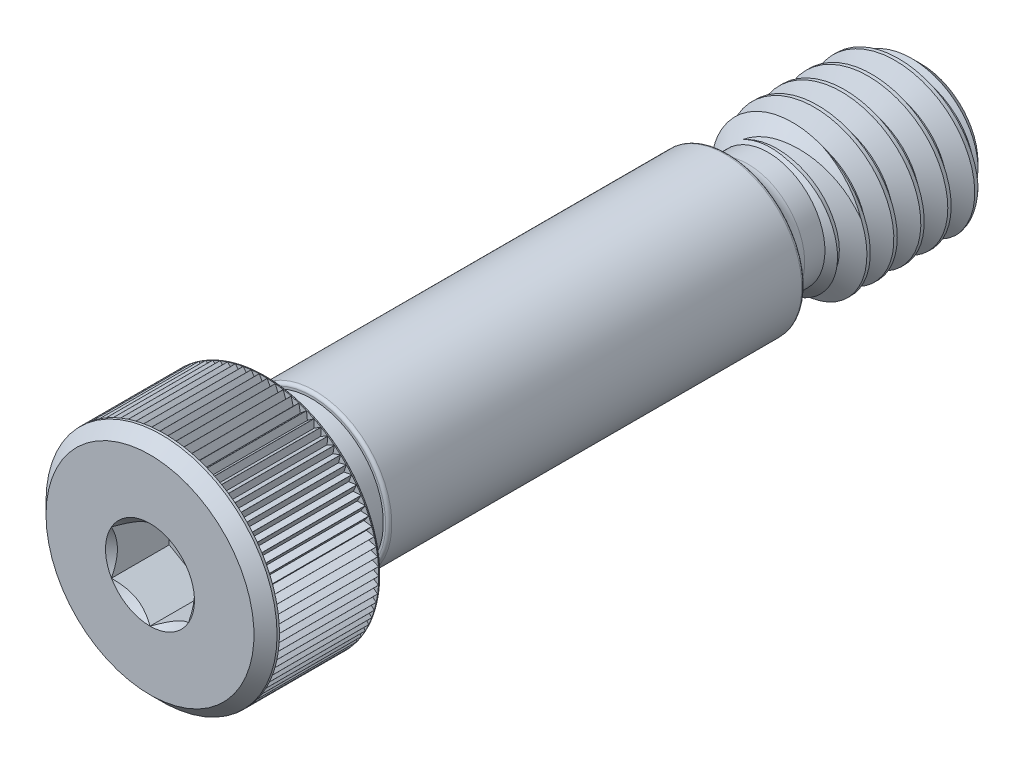
from build123d import *

# Parameters (mm, degrees)
CUT_EXTRUDE2_DEPTH     = 1.5
CUT_SWEEP1_PITCH       = 0.7
CUT_SWEEP1_HEIGHT      = 4.5
CUT_SWEEP1_RADIUS      = 2
CUT_SWEEP1_START_ANGLE = 90
CUT_EXTRUDE5_DEPTH     = 2.58
CIRPATTERN1_COUNT      = 90


with BuildPart() as part:
    # Sketch12 → Revolve1 (revolve)
    with BuildSketch(Plane(origin=(0, 0, 0), x_dir=(0, 0, -1), z_dir=(1, 0, 0)), mode=Mode.PRIVATE) as revolve1_sk:
        with BuildLine():
            Line((-10.0125, 0), (-10.0125, 2.7))
            Line((-10.0125, 2.7), (-9.7125, 3))
            Line((-9.7125, 3), (-7.0725, 3))
            ThreePointArc((-7.0725, 3), (-7.030073593, 2.982426407), (-7.0125, 2.94))
            Line((-7.0125, 2.94), (-7.0125, 1.86))
            Line((-7.0125, 1.86), (-5.8125, 1.86))
            Line((-5.8125, 1.86), (-5.8125, 1.92))
            ThreePointArc((-5.8125, 1.92), (-5.789068542, 1.976568542), (-5.7325, 2))
            Line((-5.7325, 2), (4.912812581, 2))
            ThreePointArc((4.912812581, 2), (4.965508497, 1.980192529), (4.992110091, 1.930578512))
            ThreePointArc((4.992110091, 1.930578512), (5.166683055, 1.604986531), (5.5125, 1.475))
            Line((5.5125, 1.475), (6.0375, 1.475))
            Line((6.0375, 1.475), (6.5625, 2))
            Line((6.5625, 2), (9.4875, 2))
            Line((9.4875, 2), (10.0125, 1.475))
            Line((10.0125, 1.475), (10.0125, 0))
            Line((10.0125, 0), (-10.0125, 0))
        make_face()
    revolve(revolve1_sk.sketch.rotate(Axis((0, 0, -10.0125), (0, 0, 1)), 90), axis=Axis((0, 0, -10.0125), (0, 0, 1)))

    # Sketch8 → Cut-Extrude2 (cut)
    with BuildSketch(Plane.XY.offset(10.0125)):
        Polygon((0, -1.154700538), (1, -0.577350269), (1, 0.577350269), (0, 1.154700538), (-1, 0.577350269), (-1, -0.577350269), align=None)
    extrude(amount=-CUT_EXTRUDE2_DEPTH, mode=Mode.SUBTRACT)

    # Cut-Extrude4 cone 1 section (through the dimple's axis) → Cut-Extrude4 (revolve, cut)
    with BuildSketch(Plane(origin=(0, 0, 10.0125), x_dir=(0, -1, 0), z_dir=(1, 0, 0))):
        Polygon((0, 0), (1.154700538, 0), (0, 1.154700538), align=None)
    revolve(axis=Axis((0, 0, 10.0125), (0, 0, -1)), mode=Mode.SUBTRACT)


with BuildPart() as body_2:
    # Split1: the piece on the far side of the plane
    add(part.part)
    split(bisect_by=Plane(origin=(0, 0, -6.0375), x_dir=(0, -1, 0), z_dir=(0, 0, -1)), keep=Keep.BOTTOM)


with BuildPart() as part_1:
    add(part.part)

    # Split1
    split(bisect_by=Plane(origin=(0, 0, -6.0375), x_dir=(0, -1, 0), z_dir=(0, 0, -1)), keep=Keep.TOP)

    # Cut-Sweep1: sweep along a helix
    with BuildLine() as cut_sweep1_path:
        add(Helix(CUT_SWEEP1_PITCH, CUT_SWEEP1_HEIGHT, CUT_SWEEP1_RADIUS, center=(0, 0, -10.0125), direction=(0, 0, 1), mode=Mode.PRIVATE).rotate(Axis((0, 0, -10.0125), (0, 0, 1)), CUT_SWEEP1_START_ANGLE))
    # Sketch13 → Cut-Sweep1 (sweep, cut)
    with BuildSketch(Plane(origin=(0, 0, 0), x_dir=(0, 0, -1), z_dir=(1, 0, 0))):
        Polygon((9.990625, 2.037888611), (10.646875, 2.037888611), (10.3625, 1.545336663), (10.275, 1.545336663), align=None)
    sweep(path=cut_sweep1_path.line, is_frenet=True, mode=Mode.SUBTRACT)


with BuildPart() as body_2_1:
    add(body_2.part)

    # Combine1: union part
    add(part_1.part)

    # Sketch11 → Cut-Extrude5 (cut)
    with BuildSketch(Plane.XY.offset(9.6525)):
        Polygon((0.104762308, 3), (0, 2.818546359), (-0.104762308, 3), align=None)
    cut_extrude5 = extrude(amount=-CUT_EXTRUDE5_DEPTH, mode=Mode.SUBTRACT)

    # CirPattern1: Cut-Extrude5 ×90 about axis
    cirpattern1_axis = Axis((0, 0, 0), (0, 0, 1))
    for i in range(1, CIRPATTERN1_COUNT):
        add(cut_extrude5.rotate(cirpattern1_axis, i * 360 / CIRPATTERN1_COUNT), mode=Mode.SUBTRACT)


solid = body_2_1.part
